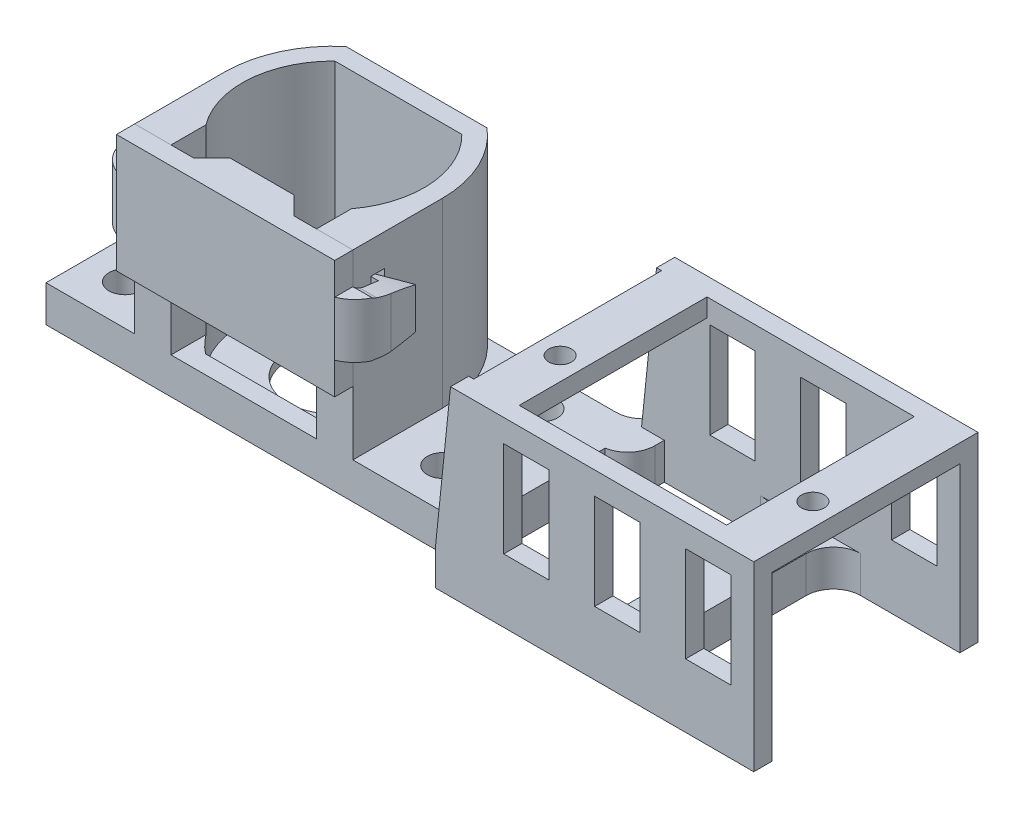
from build123d import *

# Parameters (mm, degrees)
BOSS_EXTRUDE1_DEPTH              = 20
SKETCH2_W                        = 43.5
SKETCH2_H                        = 19
SKETCH2_R                        = 1.75
BOSS_EXTRUDE2_DEPTH              = 4
CUT_EXTRUDE7_START               = -3
CUT_EXTRUDE7_DEPTH               = 3
CUT_EXTRUDE2_DEPTH               = 4
CUT_EXTRUDE4_START               = -3.841089
SKETCH11_W                       = 16
SKETCH11_H                       = 20
CUT_EXTRUDE4_DEPTH               = 3.841089
SKETCH12_W                       = 1.5
SKETCH12_H                       = 6
CUT_EXTRUDE5_DEPTH               = 1
SKETCH13_W                       = 24
SKETCH13_H                       = 13
BOSS_EXTRUDE11_DEPTH             = 2
BOSS_EXTRUDE14_REACH             = 32.324
BOSS_EXTRUDE14_DIRECTION_2_REACH = 32.324
CUT_EXTRUDE6_DEPTH               = 44.06128075
FILLET1_R                        = 4
SKETCH18_W                       = 11
SKETCH18_H                       = 13
BOSS_EXTRUDE15_DEPTH             = 2
CHAMFER1_SIZE                    = 2
FILLET2_R                        = 1
FILLET3_R                        = 1
FILLET4_R                        = 1
SKETCH19_R                       = 0.5
BOSS_EXTRUDE16_DEPTH             = 4
BOSS_EXTRUDE17_DEPTH             = 2
SKETCH23_W                       = 5
SKETCH23_H                       = 20.658910532
SKETCH23_R                       = 1.25
BOSS_EXTRUDE19_DEPTH             = 2
SKETCH25_W                       = 13.9
SKETCH25_H                       = 20.658910532
CUT_EXTRUDE8_DEPTH               = 4
FILLET5_R                        = 3


# Some blends are built 0.0001 mm under size
with BuildPart() as part:
    # Sketch1 → Boss-Extrude1 (new body)
    with BuildSketch(Plane(origin=(0, 0, 0), x_dir=(1, 0, 0), z_dir=(0, 1, 0))):
        with BuildLine():
            Line((-7.753344947, 9.158910532), (7.753344947, 9.158910532))
            ThreePointArc((7.753344947, 9.158910532), (10.886692321, 5.047764883), (12, 0))
            Line((12, 0), (12, -9.841089468))
            Line((12, -9.841089468), (6.866801153, -9.841089468))
            Line((6.866801153, -9.841089468), (-6.866801153, -9.841089468))
            Line((-6.866801153, -9.841089468), (-12, -9.841089468))
            Line((-12, -9.841089468), (-12, 0))
            ThreePointArc((-12, 0), (-10.886692321, 5.047764883), (-7.753344947, 9.158910532))
        make_face()
        with BuildLine():
            ThreePointArc((6.206232025, -7.841089468), (9.986648959, -0.51656807), (6.982120022, 7.158910532))
            Line((6.982120022, 7.158910532), (-6.982120022, 7.158910532))
            ThreePointArc((-6.982120022, 7.158910532), (-9.986648959, -0.51656807), (-6.206232025, -7.841089468))
            Line((-6.206232025, -7.841089468), (6.206232025, -7.841089468))
        make_face(mode=Mode.SUBTRACT)
    extrude(amount=BOSS_EXTRUDE1_DEPTH)

    # Sketch11 → Cut-Extrude4 (cut)
    with BuildSketch(Plane.XY.offset(9.841089468).offset(CUT_EXTRUDE4_START)):
        with Locations((0, 10)):
            Rectangle(SKETCH11_W, SKETCH11_H)
    extrude(amount=CUT_EXTRUDE4_DEPTH, mode=Mode.SUBTRACT)

    # Sketch12 → Cut-Extrude5 (cut)
    with BuildSketch(Plane.ZY.offset(12)):
        with Locations((7.091089468, 13.5)):
            Rectangle(SKETCH12_W, SKETCH12_H)
    cut_extrude5 = extrude(amount=-CUT_EXTRUDE5_DEPTH, mode=Mode.SUBTRACT)

    # Mirror2: Cut-Extrude5 across plane
    add(cut_extrude5.mirror(Plane.ZY), mode=Mode.SUBTRACT)


with BuildPart() as body_2:
    # Sketch2 → Boss-Extrude2 (new body)
    with BuildSketch(Plane.XZ):
        with Locations((0, 0.341089468)):
            Rectangle(SKETCH2_W, SKETCH2_H)
        with Locations(Location((-17.5, -5.408910532, 0), (0, 0, 270))):
            Circle(SKETCH2_R, mode=Mode.SUBTRACT)
        with Locations(Location((17.5, -5.408910532, 0), (0, 0, 270))):
            Circle(SKETCH2_R, mode=Mode.SUBTRACT)
        with Locations(Location((17.5, 5.408910532, 0), (0, 0, 270))):
            Circle(SKETCH2_R, mode=Mode.SUBTRACT)
        with Locations(Location((-17.5, 5.408910532, 0), (0, 0, 270))):
            Circle(SKETCH2_R, mode=Mode.SUBTRACT)
    extrude(amount=BOSS_EXTRUDE2_DEPTH)

    # Sketch24 → Cut-Extrude7 (cut)
    with BuildSketch(Plane(origin=(0, 0, 0), x_dir=(1, 0, 0), z_dir=(0, 1, 0)).offset(CUT_EXTRUDE7_START)):
        with BuildLine():
            Line((-6.982120022, 7.158910532), (6.982120022, 7.158910532))
            ThreePointArc((6.982120022, 7.158910532), (9.986648959, -0.51656807), (6.206232025, -7.841089468))
            Line((6.206232025, -7.841089468), (-6.206232025, -7.841089468))
            ThreePointArc((-6.206232025, -7.841089468), (-9.986648959, -0.51656807), (-6.982120022, 7.158910532))
        make_face()
    extrude(amount=CUT_EXTRUDE7_DEPTH, mode=Mode.SUBTRACT)

    # Sketch5 → Cut-Extrude2 (cut)
    with BuildSketch(Plane(origin=(0, 0, 0), x_dir=(1, 0, 0), z_dir=(0, 1, 0))):
        with BuildLine():
            Line((-3, 4), (3, 4))
            ThreePointArc((3, 4), (0, -5), (-3, 4))
        make_face()
    extrude(amount=-CUT_EXTRUDE2_DEPTH, mode=Mode.SUBTRACT)

    # Combine3: union part
    add(part.part)

    # Sketch19 → Boss-Extrude16 (add)
    with BuildSketch(Plane.XZ.offset(4)):
        Polygon((21.75, -9.158910532), (59.75, -9.158910532), (59.75, 13.5), (25.299961621, 13.5), (24.75, 9.841089468), (21.75, 9.841089468), align=None)
        with Locations(Location((48.5, 4.5, 0), (0, 0, 270))):
            Circle(SKETCH19_R, mode=Mode.SUBTRACT)
    extrude(amount=-BOSS_EXTRUDE16_DEPTH)

    # Sketch20 → Boss-Extrude17 (add)
    with BuildSketch(Plane(origin=(0, 0, -9.158910532), x_dir=(-1, 0, 0), z_dir=(0, 0, -1))):
        Polygon((-26.4, 16), (-59.75, 16), (-59.75, -4), (-24.75, -4), (-24.75, 0), align=None)
        Polygon((-57.25, 13.5), (-52.25, 13.5), (-52.25, 5.5), (-52.25, 3), (-57.25, 3), (-57.25, 5.5), align=None, mode=Mode.SUBTRACT)
        Polygon((-47.25, 5.5), (-47.25, 13.5), (-42.25, 13.5), (-42.25, 5.5), (-42.25, 3), (-47.25, 3), align=None, mode=Mode.SUBTRACT)
        Polygon((-37.25, 5.5), (-37.25, 13.5), (-32.25, 13.5), (-32.25, 5.5), (-32.25, 3), (-37.25, 3), align=None, mode=Mode.SUBTRACT)
    boss_extrude17 = extrude(amount=BOSS_EXTRUDE17_DEPTH)

    # Mirror9: Boss-Extrude17 across plane
    add(boss_extrude17.mirror(Plane(origin=(0, 0, 1.170544734), x_dir=(1, 0, 0), z_dir=(0, 0, -1))))

    # Sketch23 → Boss-Extrude19 (add)
    # profile 1 of 2: a face of its own
    with BuildSketch(Plane(origin=(0, 16, 0), x_dir=(1, 0, 0), z_dir=(0, 1, 0))):
        with Locations((29.45, -1.170544734)):
            Rectangle(SKETCH23_W, SKETCH23_H)
        with Locations(Location((29.45, -4.5, 0), (0, 0, 180))):
            Circle(SKETCH23_R, mode=Mode.SUBTRACT)
    # profile 2 of 2: a face of its own
    with BuildSketch(Plane(origin=(0, 16, 0), x_dir=(1, 0, 0), z_dir=(0, 1, 0))):
        with Locations((57.25, -1.170544734)):
            Rectangle(SKETCH23_W, SKETCH23_H)
        with Locations(Location((57.25, -4.5, 0), (0, 0, 180))):
            Circle(SKETCH23_R, mode=Mode.SUBTRACT)
    extrude(amount=-BOSS_EXTRUDE19_DEPTH)

    # Sketch25 → Cut-Extrude8 (cut)
    with BuildSketch(Plane.XZ.offset(4)):
        Polygon((27.25, 11.5), (40.85, 11.5), (40.85, -9.158910532), (27.25, -9.158910532), (27.25, -5.158910532), (24.75, -5.158910532), (24.75, 5.841089468), (27.25, 5.841089468), align=None)
        with Locations((52.8, 1.170544734)):
            Rectangle(SKETCH25_W, SKETCH25_H)
    extrude(amount=-CUT_EXTRUDE8_DEPTH, mode=Mode.SUBTRACT)

    # Fillet5
    # the kernel refuses this fillet: 3 mm, written as the material it adds along each edge
    with BuildSketch(Plane(origin=(24.75, -4, -9.158910532), x_dir=(0, 0, -1), z_dir=(0, 1, 0))) as fillet5_piece_1:
        with BuildLine():
            CenterArc((3, 2.828427125), FILLET5_R, 180, 70.528779366)
            Line((0, 2.828427125), (0, 0))
            Line((0, 0), (2, 0))
        make_face()
    extrude(amount=4)
    with BuildSketch(Plane(origin=(24.75, -4, 9.841089468), x_dir=(0.1486378195331528, 0, 0.9888917021617837), z_dir=(0, 1, 0))) as fillet5_piece_2:
        with BuildLine():
            CenterArc((2.604859365, -2.853084023), FILLET5_R, 108.005285094, 63.446720446)
            Line((-0.361815741, -2.407170565), (0, 0))
            Line((0, 0), (1.677545203, 0))
        make_face()
    extrude(amount=4)
    with BuildSketch(Plane(origin=(40.85, -4, -9.158910532), x_dir=(0, 0, 1), z_dir=(0, 1, 0))) as fillet5_piece_3:
        with BuildLine():
            CenterArc((FILLET5_R, -FILLET5_R), FILLET5_R, 90, 90)
            Line((0, -FILLET5_R), (0, 0))
            Line((0, 0), (FILLET5_R, 0))
        make_face()
    extrude(amount=4)
    with BuildSketch(Plane(origin=(40.85, -4, 11.5), x_dir=(0, 0, -1), z_dir=(0, 1, 0)), Plane(origin=(45.85, -4, 11.5), x_dir=(1, 0, 0), z_dir=(0, 1, 0)), Plane(origin=(45.85, -4, -9.158910532), x_dir=(0, 0, 1), z_dir=(0, 1, 0))) as fillet5_piece_4:
        with BuildLine():
            CenterArc((FILLET5_R, FILLET5_R), FILLET5_R, 180, 90)
            Line((0, FILLET5_R), (0, 0))
            Line((0, 0), (FILLET5_R, 0))
        make_face()
    extrude(amount=4)
    # the kernel refuses this fillet: 3 mm, written as the material it takes off along each edge
    with BuildSketch(Plane(origin=(27.25, -11.395099729, 5.841089468), x_dir=(-1, 0, 0), z_dir=(0, 1, 0))) as fillet5_2_piece_1:
        with BuildLine():
            CenterArc((3, 2.958039892), FILLET5_R, 180, 80.405931773)
            Line((0, 2.958039892), (0, 0))
            Line((0, 0), (2.5, 0))
        make_face()
    extrude(amount=18.790199458, mode=Mode.SUBTRACT)
    with BuildSketch(Plane(origin=(27.25, -11.395099729, -5.158910532), x_dir=(0, 0, -1), z_dir=(0, 1, 0))) as fillet5_2_piece_2:
        with BuildLine():
            CenterArc((2.958039892, 3), FILLET5_R, 189.594068227, 80.405931773)
            Line((0, 2.5), (0, 0))
            Line((0, 0), (2.958039892, 0))
        make_face()
    extrude(amount=18.790199458, mode=Mode.SUBTRACT)


with BuildPart() as body_3:
    # Sketch13 → Boss-Extrude11 (new body)
    with BuildSketch(Plane.XY.offset(9.841089468)):
        with Locations((0, 13.5)):
            Rectangle(SKETCH13_W, SKETCH13_H)
    extrude(amount=BOSS_EXTRUDE11_DEPTH)

    # Sketch18 → Boss-Extrude15 (add)
    with BuildSketch(Plane(origin=(0, 0, 9.841089468), x_dir=(-1, 0, 0), z_dir=(0, 0, -1))):
        with Locations((-0.023965903, 13.5)):
            Rectangle(SKETCH18_W, SKETCH18_H)
    extrude(amount=BOSS_EXTRUDE15_DEPTH)

    # Chamfer1
    chamfer1_edges = [body_3.edges().sort_by_distance(p)[0] for p in [
        (5.523965903, 13.5, 7.841089468),
        (-5.476034097, 13.5, 7.841089468),
    ]]
    chamfer(chamfer1_edges, length=CHAMFER1_SIZE - 0.0001)  # a hair under: the kernel refuses the full size


with BuildPart() as body_4:

    # Boss-Extrude14: up to this face of the body (flat: up to its plane)
    boss_extrude14_end = Plane(part.part.faces().sort_by_distance((-11.5, 16.5, 7.091089468))[0])
    # Sketch16 → Boss-Extrude14 (new, up to the picked face)
    with BuildSketch(Plane(origin=(0, 13.5, 0), x_dir=(1, 0, 0), z_dir=(0, 1, 0)), mode=Mode.PRIVATE) as boss_extrude14_sk1:
        Polygon((-12.5, -9.918701761), (-12.5, -7.541089468), (-12, -7.541089468), (-12, -6.774797955), (-14.5, -5.44334039), (-14.5, -11.841089468), (-12, -11.841089468), (-12, -9.918701761), align=None)
    boss_extrude14_tool1 = split(extrude(boss_extrude14_sk1.sketch, amount=BOSS_EXTRUDE14_REACH, mode=Mode.PRIVATE), bisect_by=boss_extrude14_end, keep=Keep.BOTH, mode=Mode.PRIVATE)
    # Sketch16 → Boss-Extrude14 (new, up to the picked face)
    with BuildSketch(Plane(origin=(0, 13.5, 0), x_dir=(1, 0, 0), z_dir=(0, 1, 0)), mode=Mode.PRIVATE) as boss_extrude14_sk2:
        Polygon((-12, -6.774797955), (-12, -7.541089468), (-11.5, -7.541089468), (-11.5, -7.041089468), align=None)
    boss_extrude14_tool2 = split(extrude(boss_extrude14_sk2.sketch, amount=BOSS_EXTRUDE14_REACH, mode=Mode.PRIVATE), bisect_by=boss_extrude14_end, keep=Keep.BOTH, mode=Mode.PRIVATE)
    add(boss_extrude14_tool1.solids().sort_by(Axis((-13.393234, 13.5, 8.983207), (0, 1, 0)))[0])
    add(boss_extrude14_tool2.solids().sort_by(Axis((-11.767524, 13.5, 7.21985), (0, 1, 0)))[0])


    # Boss-Extrude14 direction 2: up to this face of the body (flat: up to its plane)
    boss_extrude14_direction_2_end = Plane(part.part.faces().sort_by_distance((-11.5, 10.5, 7.091089468))[0])
    # Sketch16 → Boss-Extrude14 direction 2 (add, up to the picked face)
    with BuildSketch(Plane(origin=(0, 13.5, 0), x_dir=(1, 0, 0), z_dir=(0, 1, 0)), mode=Mode.PRIVATE) as boss_extrude14_direction_2_sk1:
        Polygon((-12.5, -9.918701761), (-12.5, -7.541089468), (-12, -7.541089468), (-12, -6.774797955), (-14.5, -5.44334039), (-14.5, -11.841089468), (-12, -11.841089468), (-12, -9.918701761), align=None)
    boss_extrude14_direction_2_tool1 = split(extrude(boss_extrude14_direction_2_sk1.sketch, amount=-BOSS_EXTRUDE14_DIRECTION_2_REACH, mode=Mode.PRIVATE), bisect_by=boss_extrude14_direction_2_end, keep=Keep.BOTH, mode=Mode.PRIVATE)
    # Sketch16 → Boss-Extrude14 direction 2 (add, up to the picked face)
    with BuildSketch(Plane(origin=(0, 13.5, 0), x_dir=(1, 0, 0), z_dir=(0, 1, 0)), mode=Mode.PRIVATE) as boss_extrude14_direction_2_sk2:
        Polygon((-12, -6.774797955), (-12, -7.541089468), (-11.5, -7.541089468), (-11.5, -7.041089468), align=None)
    boss_extrude14_direction_2_tool2 = split(extrude(boss_extrude14_direction_2_sk2.sketch, amount=-BOSS_EXTRUDE14_DIRECTION_2_REACH, mode=Mode.PRIVATE), bisect_by=boss_extrude14_direction_2_end, keep=Keep.BOTH, mode=Mode.PRIVATE)
    add(boss_extrude14_direction_2_tool1.solids().sort_by(Axis((-13.393234, 13.5, 8.983207), (0, -1, 0)))[0])
    add(boss_extrude14_direction_2_tool2.solids().sort_by(Axis((-11.767524, 13.5, 7.21985), (0, -1, 0)))[0])

    # Sketch17 → Cut-Extrude6 (cut, through all)
    with BuildSketch(Plane.ZY.offset(14.5)):
        with BuildLine():
            Line((5.44334039, 11.25), (5.44334039, 10.5))
            Line((5.44334039, 10.5), (9.841089468, 10.5))
            Line((9.841089468, 10.5), (9.841089468, 10.572394876))
            ThreePointArc((9.841089468, 10.572394876), (7.628568303, 10.822628982), (5.44334039, 11.25))
        make_face()
        with BuildLine():
            Line((5.44334039, 15.75), (5.44334039, 16.5))
            Line((5.44334039, 16.5), (9.841089468, 16.5))
            Line((9.841089468, 16.5), (9.841089468, 16.427605124))
            ThreePointArc((9.841089468, 16.427605124), (7.628568303, 16.177371018), (5.44334039, 15.75))
        make_face()
    extrude(amount=-CUT_EXTRUDE6_DEPTH, mode=Mode.SUBTRACT)

    # Fillet1
    # the kernel refuses this fillet: 4 mm, written as the material it takes off along each edge
    with BuildSketch(Plane(origin=(-14.5, 25.770248109, 11.841089468), x_dir=(0, 0, -1), z_dir=(0, -1, 0))) as fillet1_piece_1:
        with BuildLine():
            CenterArc((3.708099244, 4), FILLET1_R, 202.024312837, 67.975687163)
            Line((0, 2.5), (-0.074161985, 2.47))
            ThreePointArc((-0.074161985, 2.47), (-0.08, 1.25), (-0.08, 0))
            Line((-0.08, 0), (0, -0.08))
            Line((0, -0.08), (3.708099244, -0.08))
            Line((3.708099244, -0.08), (3.708099244, 0))
        make_face()
    extrude(amount=24.540496218, mode=Mode.SUBTRACT)


with BuildPart() as body_5:
    # Mirror7: mirrored copy
    add(body_4.part.mirror(Plane.ZY))


with BuildPart() as body_3_1:
    add(body_3.part)

    # Combine4: union body 5, body 4
    add(body_5.part)
    add(body_4.part)

    # Fillet2
    # the kernel refuses this fillet: 1 mm, written as the material it adds along each edge
    with BuildSketch(Plane(origin=(-12.5, 16.5, 9.918701761), x_dir=(1, 0, 0), z_dir=(0, -1, 0))) as fillet2_piece_1_section:
        with BuildLine():
            CenterArc((1, -0.866025404), FILLET2_R, 120, 60)
            Line((0, -0.866025404), (-0.02, -0.866025404))
            Line((-0.02, -0.866025404), (-0.02, 0))
            Line((-0.02, 0), (0, 0.02))
            ThreePointArc((0, 0.02), (0.25, 0.02), (0.49, 0.017320508))
            Line((0.49, 0.017320508), (0.5, 0))
        make_face()
    fillet2_piece_1 = extrude(amount=6, mode=Mode.PRIVATE)
    fillet2_piece_1 = split(fillet2_piece_1, bisect_by=Plane(origin=(-12.283959407, 16.465577859, 9.841089468), z_dir=(0, 0, 1)), keep=Keep.TOP, mode=Mode.PRIVATE)
    fillet2_piece_1 = fillet2_piece_1 - Plane(origin=(-12.283959407, -11.162462176, 11.841089468), x_dir=(0, 0.9973829200317029, -0.07230014404573416), z_dir=(-1, 0, 0)) * Cylinder(27.662462176, 16, mode=Mode.PRIVATE)
    add(fillet2_piece_1)
    with BuildSketch(Plane(origin=(-12.5, 16.5, 9.918701761), x_dir=(1, 0, 0), z_dir=(0, -1, 0))) as fillet2_piece_2_section:
        with BuildLine():
            CenterArc((1, -0.866025404), FILLET2_R, 120, 60)
            Line((0, -0.866025404), (-0.02, -0.866025404))
            Line((-0.02, -0.866025404), (-0.02, 0))
            Line((-0.02, 0), (0, 0.02))
            ThreePointArc((0, 0.02), (0.25, 0.02), (0.49, 0.017320508))
            Line((0.49, 0.017320508), (0.5, 0))
        make_face()
    fillet2_piece_2 = extrude(amount=6, mode=Mode.PRIVATE)
    fillet2_piece_2 = split(fillet2_piece_2, bisect_by=Plane(origin=(-12.283448031, 13.5, 9.841089468), z_dir=(0, 0, 1)), keep=Keep.TOP, mode=Mode.PRIVATE)
    fillet2_piece_2 = fillet2_piece_2 & Plane(origin=(-12.283448031, -11.162462176, 11.841089468), x_dir=(0, 0.9973829200317029, -0.07230014404573416), z_dir=(-1, 0, 0)) * Cylinder(27.662462176, 16, mode=Mode.PRIVATE)
    fillet2_piece_2 = fillet2_piece_2 & Plane(origin=(-12.283448031, 38.162462176, 11.841089468), x_dir=(0, -0.9973829200317027, -0.07230014404573669), z_dir=(-1, 0, 0)) * Cylinder(27.662462176, 16, mode=Mode.PRIVATE)
    add(fillet2_piece_2)
    with BuildSketch(Plane(origin=(-12.5, 16.5, 9.918701761), x_dir=(1, 0, 0), z_dir=(0, -1, 0))) as fillet2_piece_3_section:
        with BuildLine():
            CenterArc((1, -0.866025404), FILLET2_R, 120, 60)
            Line((0, -0.866025404), (-0.02, -0.866025404))
            Line((-0.02, -0.866025404), (-0.02, 0))
            Line((-0.02, 0), (0, 0.02))
            ThreePointArc((0, 0.02), (0.25, 0.02), (0.49, 0.017320508))
            Line((0.49, 0.017320508), (0.5, 0))
        make_face()
    fillet2_piece_3 = extrude(amount=6, mode=Mode.PRIVATE)
    fillet2_piece_3 = split(fillet2_piece_3, bisect_by=Plane(origin=(-12.407057468, 13.5, 9.841089468), z_dir=(0, 0, -1)), keep=Keep.TOP, mode=Mode.PRIVATE)
    fillet2_piece_3 = fillet2_piece_3 & Plane(origin=(-12.407057468, -11.162462176, 11.841089468), x_dir=(0, 0.9973829200317029, -0.07230014404573416), z_dir=(-1, 0, 0)) * Cylinder(27.662462176, 16, mode=Mode.PRIVATE)
    fillet2_piece_3 = fillet2_piece_3 & Plane(origin=(-12.407057468, 38.162462176, 11.841089468), x_dir=(0, -0.9973829200317027, -0.07230014404573669), z_dir=(-1, 0, 0)) * Cylinder(27.662462176, 16, mode=Mode.PRIVATE)
    add(fillet2_piece_3)
    with BuildSketch(Plane(origin=(-12.5, 16.5, 9.918701761), x_dir=(1, 0, 0), z_dir=(0, -1, 0))) as fillet2_piece_4_section:
        with BuildLine():
            CenterArc((1, -0.866025404), FILLET2_R, 120, 60)
            Line((0, -0.866025404), (-0.02, -0.866025404))
            Line((-0.02, -0.866025404), (-0.02, 0))
            Line((-0.02, 0), (0, 0.02))
            ThreePointArc((0, 0.02), (0.25, 0.02), (0.49, 0.017320508))
            Line((0.49, 0.017320508), (0.5, 0))
        make_face()
    fillet2_piece_4 = extrude(amount=6, mode=Mode.PRIVATE)
    fillet2_piece_4 = split(fillet2_piece_4, bisect_by=Plane(origin=(-12.283959407, 10.534422141, 9.841089468), z_dir=(0, 0, 1)), keep=Keep.TOP, mode=Mode.PRIVATE)
    fillet2_piece_4 = fillet2_piece_4 - Plane(origin=(-12.283959407, 38.162462176, 11.841089468), x_dir=(0, -0.9973829200317027, -0.07230014404573669), z_dir=(-1, 0, 0)) * Cylinder(27.662462176, 16, mode=Mode.PRIVATE)
    add(fillet2_piece_4)

    # Fillet3
    # the kernel refuses this fillet: 1 mm, written as the material it adds along each edge
    with BuildSketch(Plane(origin=(12.5, 16.5, 9.918701761), x_dir=(0, 0, -1), z_dir=(0, -1, 0))) as fillet3_piece_1_section:
        with BuildLine():
            CenterArc((0.866025404, -1), FILLET3_R, 90, 60)
            Line((0, -0.5), (-0.017320508, -0.49))
            ThreePointArc((-0.017320508, -0.49), (-0.02, -0.25), (-0.02, 0))
            Line((-0.02, 0), (0, 0.02))
            Line((0, 0.02), (0.866025404, 0.02))
            Line((0.866025404, 0.02), (0.866025404, 0))
        make_face()
    fillet3_piece_1 = extrude(amount=6, mode=Mode.PRIVATE)
    fillet3_piece_1 = split(fillet3_piece_1, bisect_by=Plane(origin=(12.283959407, 16.465577859, 9.841089468), z_dir=(0, 0, 1)), keep=Keep.TOP, mode=Mode.PRIVATE)
    fillet3_piece_1 = fillet3_piece_1 - Plane(origin=(12.283959407, -11.162462176, 11.841089468), x_dir=(0, 0.9973829200317029, -0.07230014404573416), z_dir=(1, 0, 0)) * Cylinder(27.662462176, 16, mode=Mode.PRIVATE)
    add(fillet3_piece_1)
    with BuildSketch(Plane(origin=(12.5, 16.5, 9.918701761), x_dir=(0, 0, -1), z_dir=(0, -1, 0))) as fillet3_piece_2_section:
        with BuildLine():
            CenterArc((0.866025404, -1), FILLET3_R, 90, 60)
            Line((0, -0.5), (-0.017320508, -0.49))
            ThreePointArc((-0.017320508, -0.49), (-0.02, -0.25), (-0.02, 0))
            Line((-0.02, 0), (0, 0.02))
            Line((0, 0.02), (0.866025404, 0.02))
            Line((0.866025404, 0.02), (0.866025404, 0))
        make_face()
    fillet3_piece_2 = extrude(amount=6, mode=Mode.PRIVATE)
    fillet3_piece_2 = split(fillet3_piece_2, bisect_by=Plane(origin=(12.407057477, 13.5, 9.841089468), z_dir=(0, 0, -1)), keep=Keep.TOP, mode=Mode.PRIVATE)
    fillet3_piece_2 = fillet3_piece_2 & Plane(origin=(12.407057477, -11.162462176, 11.841089468), x_dir=(0, 0.9973829200317029, -0.07230014404573416), z_dir=(1, 0, 0)) * Cylinder(27.662462176, 16, mode=Mode.PRIVATE)
    fillet3_piece_2 = fillet3_piece_2 & Plane(origin=(12.407057477, 38.162462176, 11.841089468), x_dir=(0, -0.9973829200317027, -0.07230014404573669), z_dir=(1, 0, 0)) * Cylinder(27.662462176, 16, mode=Mode.PRIVATE)
    add(fillet3_piece_2)
    with BuildSketch(Plane(origin=(12.5, 16.5, 9.918701761), x_dir=(0, 0, -1), z_dir=(0, -1, 0))) as fillet3_piece_3_section:
        with BuildLine():
            CenterArc((0.866025404, -1), FILLET3_R, 90, 60)
            Line((0, -0.5), (-0.017320508, -0.49))
            ThreePointArc((-0.017320508, -0.49), (-0.02, -0.25), (-0.02, 0))
            Line((-0.02, 0), (0, 0.02))
            Line((0, 0.02), (0.866025404, 0.02))
            Line((0.866025404, 0.02), (0.866025404, 0))
        make_face()
    fillet3_piece_3 = extrude(amount=6, mode=Mode.PRIVATE)
    fillet3_piece_3 = split(fillet3_piece_3, bisect_by=Plane(origin=(12.283448031, 13.5, 9.841089468), z_dir=(0, 0, 1)), keep=Keep.TOP, mode=Mode.PRIVATE)
    fillet3_piece_3 = fillet3_piece_3 & Plane(origin=(12.283448031, -11.162462176, 11.841089468), x_dir=(0, 0.9973829200317029, -0.07230014404573416), z_dir=(1, 0, 0)) * Cylinder(27.662462176, 16, mode=Mode.PRIVATE)
    fillet3_piece_3 = fillet3_piece_3 & Plane(origin=(12.283448031, 38.162462176, 11.841089468), x_dir=(0, -0.9973829200317027, -0.07230014404573669), z_dir=(1, 0, 0)) * Cylinder(27.662462176, 16, mode=Mode.PRIVATE)
    add(fillet3_piece_3)
    with BuildSketch(Plane(origin=(12.5, 16.5, 9.918701761), x_dir=(0, 0, -1), z_dir=(0, -1, 0))) as fillet3_piece_4_section:
        with BuildLine():
            CenterArc((0.866025404, -1), FILLET3_R, 90, 60)
            Line((0, -0.5), (-0.017320508, -0.49))
            ThreePointArc((-0.017320508, -0.49), (-0.02, -0.25), (-0.02, 0))
            Line((-0.02, 0), (0, 0.02))
            Line((0, 0.02), (0.866025404, 0.02))
            Line((0.866025404, 0.02), (0.866025404, 0))
        make_face()
    fillet3_piece_4 = extrude(amount=6, mode=Mode.PRIVATE)
    fillet3_piece_4 = split(fillet3_piece_4, bisect_by=Plane(origin=(12.283959407, 10.534422141, 9.841089468), z_dir=(0, 0, 1)), keep=Keep.TOP, mode=Mode.PRIVATE)
    fillet3_piece_4 = fillet3_piece_4 - Plane(origin=(12.283959407, 38.162462176, 11.841089468), x_dir=(0, -0.9973829200317027, -0.07230014404573669), z_dir=(1, 0, 0)) * Cylinder(27.662462176, 16, mode=Mode.PRIVATE)
    add(fillet3_piece_4)

    # Fillet4
    # the kernel refuses this fillet: 1 mm, written as the material it adds along each edge
    with BuildSketch(Plane(origin=(-15.019031205, 16.427605124, 9.841089468), x_dir=(0, -0.07880352823826493, -0.9968901664362033), z_dir=(1, 0, 0))) as fillet4_piece_1_section:
        with BuildLine():
            CenterArc((0.36735062, 0.999978732), FILLET4_R, 248.095812594, 21.530502229)
            Line((-0.005704972, 0.07216974), (0, 0))
            ThreePointArc((0, 0), (0.180414315, 0.000588336), (0.360828629, 0))
        make_face()
    fillet4_piece_1 = extrude(amount=2.519031205, mode=Mode.PRIVATE)
    fillet4_piece_1 = fillet4_piece_1 & Plane(origin=(-10.5, 16.430713391, 8.132990225), x_dir=(0, 0, -1), z_dir=(0, 1, 0)) * Cylinder(4, 7, mode=Mode.PRIVATE)
    add(fillet4_piece_1)
    with BuildSketch(Plane(origin=(12.5, 10.572394876, 9.841089468), x_dir=(0, -1.0, 2.0365753290782277e-12), z_dir=(1, 0, 0))) as fillet4_piece_2_section:
        with BuildLine():
            CenterArc((0.967920439, 0.445010073), FILLET4_R, 184.893480999, 21.530502229)
            ThreePointArc((-0.028434569, 0.359706513), (-0.013630778, 0.179899619), (0, 0))
            Line((0, 0), (0.072394876, 0))
        make_face()
    fillet4_piece_2 = extrude(amount=2.519031205, mode=Mode.PRIVATE)
    fillet4_piece_2 = fillet4_piece_2 & Plane(origin=(10.5, 10.569286609, 8.132990225), x_dir=(0, 0, -1), z_dir=(0, 1, 0)) * Cylinder(4, 7, mode=Mode.PRIVATE)
    add(fillet4_piece_2)
    with BuildSketch(Plane(origin=(15.019031205, 16.427605124, 9.841089468), x_dir=(0, -0.07880352823826996, -0.9968901664362029), z_dir=(-1, 0, 0))) as fillet4_piece_3_section:
        with BuildLine():
            CenterArc((0.36735062, -0.999978732), FILLET4_R, 90.373685177, 21.530502229)
            Line((-0.005704972, -0.07216974), (0, 0))
            ThreePointArc((0, 0), (0.180414315, -0.000588336), (0.360828629, 0))
        make_face()
    fillet4_piece_3 = extrude(amount=2.519031205, mode=Mode.PRIVATE)
    fillet4_piece_3 = fillet4_piece_3 & Plane(origin=(10.5, 16.430713391, 8.132990225), x_dir=(0, 0, -1), z_dir=(0, 1, 0)) * Cylinder(4, 7, mode=Mode.PRIVATE)
    add(fillet4_piece_3)
    with BuildSketch(Plane(origin=(-15.019031205, 10.572394876, 9.841089468), x_dir=(0, -1.0, -4.637502857770301e-12), z_dir=(1, 0, 0))) as fillet4_piece_4_section:
        with BuildLine():
            CenterArc((0.967920439, 0.445010073), FILLET4_R, 184.893480999, 21.530502229)
            ThreePointArc((-0.028434569, 0.359706513), (-0.013630778, 0.179899619), (0, 0))
            Line((0, 0), (0.072394876, 0))
        make_face()
    fillet4_piece_4 = extrude(amount=2.519031205, mode=Mode.PRIVATE)
    fillet4_piece_4 = fillet4_piece_4 & Plane(origin=(-10.5, 10.569286609, 8.132990225), x_dir=(0, 0, -1), z_dir=(0, 1, 0)) * Cylinder(4, 7, mode=Mode.PRIVATE)
    add(fillet4_piece_4)
    with BuildSketch(Plane(origin=(-11.21307456, 10.572394876, 9.841089468), x_dir=(0, -1, 0), z_dir=(-1, 0, 0))) as fillet4_piece_5_section:
        with BuildLine():
            CenterArc((0.967920439, -0.445010073), FILLET4_R, 153.576016772, 21.530502229)
            ThreePointArc((-0.028434569, -0.359706513), (-0.013630778, -0.179899619), (0, 0))
            Line((0, 0), (0.072394876, 0))
        make_face()
    fillet4_piece_5 = extrude(amount=1.28692544, mode=Mode.PRIVATE)
    fillet4_piece_5 = fillet4_piece_5 - Plane(origin=(-11.5, 10.569286609, 9.052676357), x_dir=(1, 0, 0), z_dir=(0, 1, 0)) * Cylinder(1, 5, mode=Mode.PRIVATE)
    add(fillet4_piece_5)
    with BuildSketch(Plane(origin=(11.21307456, 16.427605124, 9.841089468), x_dir=(0, -0.07880352823825836, -0.9968901664362038), z_dir=(1, 0, 0))) as fillet4_piece_6_section:
        with BuildLine():
            CenterArc((0.36735062, 0.999978732), FILLET4_R, 248.095812594, 21.530502229)
            Line((-0.005704972, 0.07216974), (0, 0))
            ThreePointArc((0, 0), (0.180414315, 0.000588336), (0.360828629, 0))
        make_face()
    fillet4_piece_6 = extrude(amount=1.28692544, mode=Mode.PRIVATE)
    fillet4_piece_6 = fillet4_piece_6 - Plane(origin=(11.5, 16.430713391, 9.052676357), x_dir=(0, 0, -1), z_dir=(0, 1, 0)) * Cylinder(1, 5, mode=Mode.PRIVATE)
    add(fillet4_piece_6)
    with BuildSketch(Plane(origin=(11.21307456, 10.572394876, 9.841089468), x_dir=(0, -1, 0), z_dir=(1, 0, 0))) as fillet4_piece_7_section:
        with BuildLine():
            CenterArc((0.967920439, 0.445010073), FILLET4_R, 184.893480999, 21.530502229)
            ThreePointArc((-0.028434569, 0.359706513), (-0.013630778, 0.179899619), (0, 0))
            Line((0, 0), (0.072394876, 0))
        make_face()
    fillet4_piece_7 = extrude(amount=1.28692544, mode=Mode.PRIVATE)
    fillet4_piece_7 = fillet4_piece_7 - Plane(origin=(11.5, 10.569286609, 9.052676357), x_dir=(0, 0, -1), z_dir=(0, 1, 0)) * Cylinder(1, 5, mode=Mode.PRIVATE)
    add(fillet4_piece_7)
    with BuildSketch(Plane(origin=(-11.21307456, 16.427605124, 9.841089468), x_dir=(0, -0.07880352823825526, -0.9968901664362041), z_dir=(-1, 0, 0))) as fillet4_piece_8_section:
        with BuildLine():
            CenterArc((0.36735062, -0.999978732), FILLET4_R, 90.373685177, 21.530502229)
            Line((-0.005704972, -0.07216974), (0, 0))
            ThreePointArc((0, 0), (0.180414315, -0.000588336), (0.360828629, 0))
        make_face()
    fillet4_piece_8 = extrude(amount=1.28692544, mode=Mode.PRIVATE)
    fillet4_piece_8 = fillet4_piece_8 - Plane(origin=(-11.5, 16.430713391, 9.052676357), x_dir=(1, 0, 0), z_dir=(0, 1, 0)) * Cylinder(1, 5, mode=Mode.PRIVATE)
    add(fillet4_piece_8)


solid = Compound([body_2.part, body_3_1.part])
